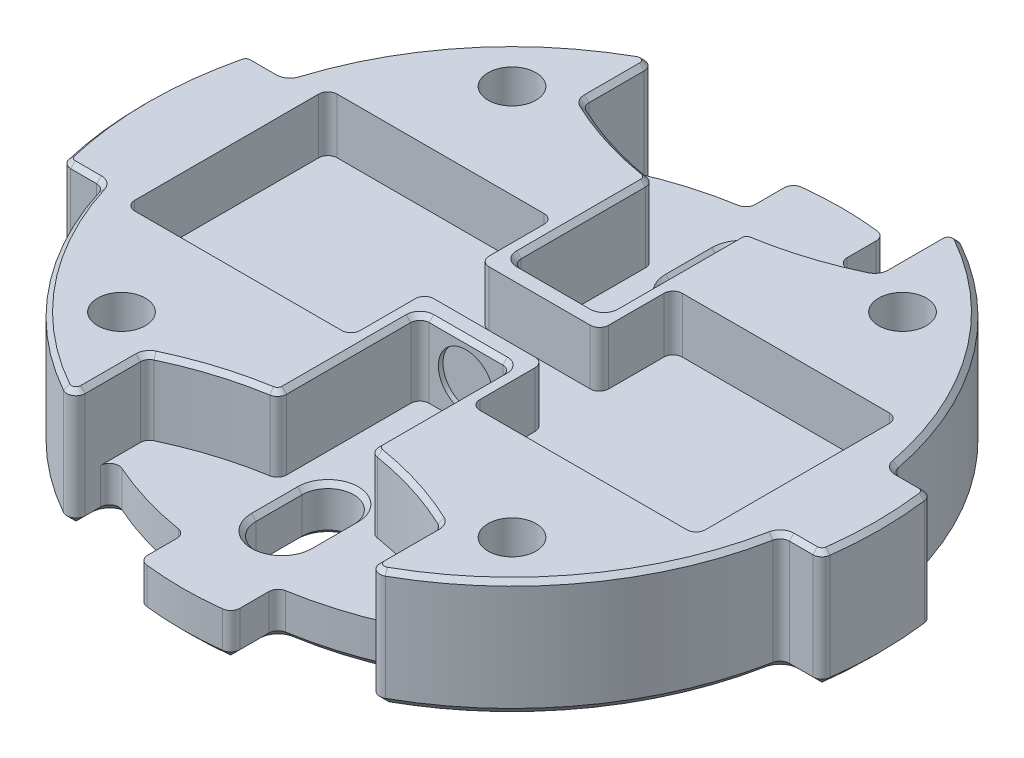
from build123d import *

# Parameters (mm, degrees)
EXTRUDE_1_DEPTH      = 13
CUT_EXTRUDE_START    = -8.1
CUT_EXTRUDE_1_DEPTH  = 8.1
CUT_EXTRUDE_START_2  = -8
CUT_EXTRUDE_2_DEPTH  = 8
CUT_EXTRUDE_6_DEPTH  = 6
FILLET_1_R           = 1
CUT_EXTRUDE_7_DEPTH  = 6
CHAMFER_2_SIZE       = 0.5
CHAMFER_4_SIZE       = 1
SKETCH_9_R           = 3
CUT_EXTRUDE_8_DEPTH  = 0.5
CUT_EXTRUDE_START_3  = -0.5
SKETCH_10_R          = 3
CUT_EXTRUDE_9_DEPTH  = 0.5
SKETCH_11_R          = 2.6
CUT_EXTRUDE_10_DEPTH = 15
SKETCH_12_R          = 4.5
CUT_EXTRUDE_11_DEPTH = 5.2
CHAMFER_5_SIZE       = 0.5


with BuildPart() as part:
    # 草图1 → 凸台-拉伸1 (new body)
    with BuildSketch(Plane(origin=(0, 0, 0), x_dir=(1, 0, 0), z_dir=(0, 1, 0))):
        with BuildLine():
            Line((-38.729833462, 10), (-34.374990909, 10))
            ThreePointArc((-34.374990909, 10), (2.052065392, 35.741139148), (35.293625487, 6))
            Line((35.293625487, 6), (39.547439867, 6))
            ThreePointArc((39.547439867, 6), (40, 0), (39.547439867, -6))
            Line((39.547439867, -6), (35.293625487, -6))
            ThreePointArc((35.293625487, -6), (2.052065392, -35.741139148), (-34.374990909, -10))
            Line((-34.374990909, -10), (-38.729833462, -10))
            ThreePointArc((-38.729833462, -10), (-40, 0), (-38.729833462, 10))
        make_face()
    extrude(amount=EXTRUDE_1_DEPTH)

    # 草图2 → 切除-拉伸1 (cut)
    with BuildSketch(Plane(origin=(0, 13, 0), x_dir=(1, 0, 0), z_dir=(0, 1, 0)).offset(CUT_EXTRUDE_START)):
        with BuildLine():
            Line((5, -5), (-5, -5))
            Line((-5, -5), (-5, -20.34891306))
            ThreePointArc((-5, -20.34891306), (-10.636893163, -21.607319037), (-16, -23.750969007))
            Line((-16, -23.750969007), (-16, -32.025614748))
            ThreePointArc((-16, -32.025614748), (0, -35.8), (16, -32.025614748))
            Line((16, -32.025614748), (16, -23.750969007))
            ThreePointArc((16, -23.750969007), (10.636893163, -21.607319037), (5, -20.34891306))
            Line((5, -20.34891306), (5, -5))
        make_face()
        with BuildLine():
            ThreePointArc((-5, 20.34891306), (-10.636893163, 21.607319037), (-16, 23.750969007))
            Line((-16, 23.750969007), (-16, 32.025614748))
            ThreePointArc((-16, 32.025614748), (0, 35.8), (16, 32.025614748))
            Line((16, 32.025614748), (16, 23.750969007))
            ThreePointArc((16, 23.750969007), (10.636893163, 21.607319037), (5, 20.34891306))
            Line((5, 20.34891306), (5, 5))
            Line((5, 5), (-5, 5))
            Line((-5, 5), (-5, 20.34891306))
        make_face()
    extrude(amount=CUT_EXTRUDE_1_DEPTH, mode=Mode.SUBTRACT)

    # 草图3 → 切除-拉伸2 (cut)
    with BuildSketch(Plane(origin=(0, 4.9, 0), x_dir=(1, 0, 0), z_dir=(0, 1, 0)).offset(CUT_EXTRUDE_START_2)):
        with BuildLine():
            Line((-5, 30.550105485), (-5, 35.449118466))
            ThreePointArc((-5, 35.449118466), (-10.63861337, 34.182742804), (-16, 32.025614748))
            Line((-16, 32.025614748), (-16, 27.137361435))
            ThreePointArc((-16, 27.137361435), (-10.63774908, 29.287728045), (-5, 30.550105485))
        make_face()
        with BuildLine():
            Line((5, 30.550105485), (5, 35.449118466))
            ThreePointArc((5, 35.449118466), (10.63861337, 34.182742804), (16, 32.025614748))
            Line((16, 32.025614748), (16, 27.137361435))
            ThreePointArc((16, 27.137361435), (10.63774908, 29.287728045), (5, 30.550105485))
        make_face()
        with BuildLine():
            Line((-5, -30.550105485), (-5, -35.449118466))
            ThreePointArc((-5, -35.449118466), (-10.63861337, -34.182742804), (-16, -32.025614748))
            Line((-16, -32.025614748), (-16, -27.137361435))
            ThreePointArc((-16, -27.137361435), (-10.63774908, -29.287728045), (-5, -30.550105485))
        make_face()
        with BuildLine():
            Line((5, -30.550105485), (5, -35.449118466))
            ThreePointArc((5, -35.449118466), (10.63861337, -34.182742804), (16, -32.025614748))
            Line((16, -32.025614748), (16, -27.137361435))
            ThreePointArc((16, -27.137361435), (10.63774908, -29.287728045), (5, -30.550105485))
        make_face()
    extrude(amount=CUT_EXTRUDE_2_DEPTH, mode=Mode.SUBTRACT)

    # 草图7 → 切除-拉伸6 (cut)
    with BuildSketch(Plane(origin=(0, 13, 0), x_dir=(1, 0, 0), z_dir=(0, 1, 0))):
        Polygon((-31, 11), (-6.5, 11), (-6.5, 3), (6.5, 3), (6.5, 11), (31, 11), (31, -11), (6.5, -11), (6.5, -3), (-6.5, -3), (-6.5, -11), (-31, -11), align=None)
    extrude(amount=-CUT_EXTRUDE_6_DEPTH, mode=Mode.SUBTRACT)

    # 圆角1
    fillet_1_edges = [part.edges().sort_by_distance(p)[0] for p in [
        (-16, 2.45, 27.137361435),
        (-5, 2.45, 30.550105485),
        (-5, 2.45, 35.449118466),
        (5, 2.45, 30.550105485),
        (16, 2.45, 27.137361435),
        (5, 2.45, 35.449118466),
        (-5, 2.45, -30.550105485),
        (-16, 2.45, -27.137361435),
        (-5, 2.45, -35.449118466),
        (-38.729833462, 6.5, -10),
        (-34.374990909, 6.5, -10),
        (35.293625487, 6.5, -6),
        (39.547439867, 6.5, -6),
        (39.547439867, 6.5, 6),
        (35.293625487, 6.5, 6),
        (-34.374990909, 6.5, 10),
        (-38.729833462, 6.5, 10),
        (-31, 10, 11),
        (-31, 10, -11),
        (-6.5, 10, -11),
        (-6.5, 10, -3),
        (6.5, 10, -3),
        (6.5, 10, -11),
        (31, 10, -11),
        (31, 10, 11),
        (6.5, 10, 11),
        (6.5, 10, 3),
        (-6.5, 10, 3),
        (-6.5, 10, 11),
        (-5, 8.95, 20.34891306),
        (-5, 8.95, 5),
        (5, 8.95, 5),
        (5, 8.95, 20.34891306),
        (16, 8.95, 23.750969007),
        (16, 6.5, 32.025614748),
        (-16, 6.5, 32.025614748),
        (-16, 8.95, 23.750969007),
        (-5, 8.95, -5),
        (-5, 8.95, -20.34891306),
        (-16, 8.95, -23.750969007),
        (-16, 6.5, -32.025614748),
        (16, 6.5, -32.025614748),
        (16, 8.95, -23.750969007),
        (5, 8.95, -20.34891306),
        (5, 8.95, -5),
        (5, 2.45, -35.449118466),
        (16, 2.45, -27.137361435),
        (5, 2.45, -30.550105485),
    ]]
    fillet(fillet_1_edges, radius=FILLET_1_R)

    # 草图8 → 切除-拉伸7 (cut)
    with BuildSketch(Plane(origin=(0, 4.9, 0), x_dir=(1, 0, 0), z_dir=(0, 1, 0))):
        with BuildLine():
            Line((2.8, -20), (2.8, -25))
            ThreePointArc((2.8, -25), (0, -27.8), (-2.8, -25))
            Line((-2.8, -25), (-2.8, -20))
            ThreePointArc((-2.8, -20), (0, -17.2), (2.8, -20))
        make_face()
        with BuildLine():
            Line((2.8, 20), (2.8, 25))
            ThreePointArc((2.8, 25), (0, 27.8), (-2.8, 25))
            Line((-2.8, 25), (-2.8, 20))
            ThreePointArc((-2.8, 20), (0, 17.2), (2.8, 20))
        make_face()
    extrude(amount=-CUT_EXTRUDE_7_DEPTH, mode=Mode.SUBTRACT)

    # 倒角2
    chamfer_2_edges = [part.edges().sort_by_distance(p)[0] for p in [
        (0, 0, 17.2),
        (2.8, 0, 22.5),
        (0, 0, 27.8),
        (-2.8, 0, 22.5),
        (0, 4.9, 17.2),
        (-2.8, 4.9, 22.5),
        (0, 4.9, 27.8),
        (2.8, 4.9, 22.5),
        (0, 0, -17.2),
        (-2.8, 0, -22.5),
        (0, 0, -27.8),
        (2.8, 0, -22.5),
        (0, 4.9, -17.2),
        (2.8, 4.9, -22.5),
        (0, 4.9, -27.8),
        (-2.8, 4.9, -22.5),
    ]]
    chamfer(chamfer_2_edges, length=CHAMFER_2_SIZE)

    # 倒角4
    chamfer_4_edges = [part.edges().sort_by_distance(p)[0] for p in [
        (-16, 0, -29.539379324),
        (16, 0, -29.539379324),
        (16, 0, 29.539379324),
        (-16, 0, 29.539379324),
        (29.013579763, 0, 20.972653369),
        (10.299242352, 0, -29.390923323),
        (29.013579763, 0, -20.972653369),
        (37.403132307, 0, -6),
        (40, 0, 0),
        (37.403132307, 0, 6),
        (10.299242352, 0, 29.390923323),
        (5, 0, 32.989139032),
        (0, 0, 35.8),
        (-5, 0, 32.989139032),
        (-10.299242352, 0, 29.390923323),
        (-27.7923273, 0, 22.566048464),
        (-36.532424459, 0, 10),
        (-40, 0, 0),
        (-36.532424459, 0, -10),
        (-27.7923273, 0, -22.566048464),
        (-10.299242352, 0, -29.390923323),
        (-5, 0, -32.989139032),
        (0, 0, -35.8),
        (5, 0, -32.989139032),
        (39.338384503, 0, 5.751067616),
        (39.338384503, 0, -5.751067616),
        (16.494285529, 0, -31.227812477),
        (4.746639983, 0, -35.23457892),
        (-4.746639983, 0, -35.23457892),
        (-16.494285529, 0, -31.227812477),
        (-38.567505595, 0, -9.784464541),
        (-38.567505595, 0, 9.784464541),
        (-16.494285529, 0, 31.227812477),
        (-4.746639983, 0, 35.23457892),
        (4.746639983, 0, 35.23457892),
        (16.494285529, 0, 31.227812477),
        (15.544745782, 0, 27.875045853),
        (5.237569142, 0, 30.761857784),
        (-5.237569142, 0, 30.761857784),
        (-15.544745782, 0, 27.875045853),
        (-34.525449873, 0, 10.194111347),
        (-34.525449873, 0, -10.194111347),
        (-15.544745782, 0, -27.875045853),
        (-5.237569142, 0, -30.761857784),
        (5.237569142, 0, -30.761857784),
        (15.544745782, 0, -27.875045853),
        (35.491794705, 0, -6.228567115),
        (35.491794705, 0, 6.228567115),
    ]]
    chamfer(chamfer_4_edges, length=CHAMFER_4_SIZE)

    # 草图9 → 切除-拉伸8 (cut)
    with BuildSketch(Plane(origin=(0, 0, -5), x_dir=(-1, 0, 0), z_dir=(0, 0, -1))):
        with Locations((0, 8.95)):
            Circle(SKETCH_9_R)
    extrude(amount=-CUT_EXTRUDE_8_DEPTH, mode=Mode.SUBTRACT)

    # 草图10 → 切除-拉伸9 (cut)
    with BuildSketch(Plane.XY.offset(5).offset(CUT_EXTRUDE_START_3)):
        with Locations(Location((0, 8.95, 0), (0, 0, 180))):
            Circle(SKETCH_10_R)
    extrude(amount=CUT_EXTRUDE_9_DEPTH, mode=Mode.SUBTRACT)

    # 草图11 → 切除-拉伸10 (cut)
    with BuildSketch(Plane.XZ):
        with Locations(Location((-21.213203436, 21.213203436, 0), (0, 0, 270))):
            Circle(SKETCH_11_R)
        with Locations(Location((21.213203436, 21.213203436, 0), (0, 0, 270))):
            Circle(SKETCH_11_R)
        with Locations(Location((21.213203436, -21.213203436, 0), (0, 0, 270))):
            Circle(SKETCH_11_R)
        with Locations(Location((-21.213203436, -21.213203436, 0), (0, 0, 270))):
            Circle(SKETCH_11_R)
    extrude(amount=-CUT_EXTRUDE_10_DEPTH, mode=Mode.SUBTRACT)

    # 草图12 → 切除-拉伸11 (cut)
    with BuildSketch(Plane.XZ):
        with Locations(Location((-21.213203436, 21.213203436, 0), (0, 0, 270))):
            Circle(SKETCH_12_R)
        with Locations(Location((21.213203436, 21.213203436, 0), (0, 0, 270))):
            Circle(SKETCH_12_R)
        with Locations(Location((21.213203436, -21.213203436, 0), (0, 0, 270))):
            Circle(SKETCH_12_R)
        with Locations(Location((-21.213203436, -21.213203436, 0), (0, 0, 270))):
            Circle(SKETCH_12_R)
    extrude(amount=-CUT_EXTRUDE_11_DEPTH, mode=Mode.SUBTRACT)

    # 倒角5
    # the kernel refuses this chamfer: 0.5 mm, written as the material it takes off along each edge
    with BuildSketch(Plane(origin=(0, 13, -56), x_dir=(-0.1621621621621622, 0, 0.9867641223529018), z_dir=(0.9867641223529018, 0, 0.1621621621621622))) as chamfer_5_piece_1:
        Polygon((36 + CHAMFER_5_SIZE, 0), (36, CHAMFER_5_SIZE), (36, 0), align=None)
    revolve(axis=Axis((0, 13, -56), (0, -1, 0)), revolution_arc=16.044515341, mode=Mode.SUBTRACT)
    with BuildSketch(Plane(origin=(-16, 13, -24.377223398), x_dir=(0.02749587661059945, -0.9996219169112963, 0), z_dir=(0, 0, -1)), Plane(origin=(16, 13, -30.365111559), x_dir=(-0.027495876610585647, -0.9996219169112968, 0), z_dir=(0, 0, 1))) as chamfer_5_piece_2:
        Polygon((CHAMFER_5_SIZE * 0.999621916911, CHAMFER_5_SIZE * 0.0274958766106), (-CHAMFER_5_SIZE * 0.0274958766106, CHAMFER_5_SIZE * 0.999621916911), (0, 0), align=None)
    extrude(amount=5.987888161, mode=Mode.SUBTRACT)
    with BuildSketch(Plane(origin=(0, 13, -56), x_dir=(0.42857142857142727, 0, 0.903507902905252), z_dir=(0.903507902905252, 0, -0.42857142857142727))) as chamfer_5_piece_3:
        Polygon((36 + CHAMFER_5_SIZE, 0), (36, CHAMFER_5_SIZE), (36, 0), align=None)
    revolve(axis=Axis((0, 13, -56), (0, -1, 0)), revolution_arc=16.044515341, mode=Mode.SUBTRACT)
    with BuildSketch(Plane(origin=(0, 13, 56), x_dir=(0.42857142857142805, 0, -0.9035079029052516), z_dir=(0.9035079029052516, 0, 0.42857142857142805))) as chamfer_5_piece_4:
        Polygon((36 + CHAMFER_5_SIZE, 0), (36, -CHAMFER_5_SIZE), (36, 0), align=None)
    revolve(axis=Axis((0, 13, 56), (0, 1, 0)), revolution_arc=16.044515341, mode=Mode.SUBTRACT)
    with BuildSketch(Plane(origin=(16, 13, 30.365111559), x_dir=(-0.027495876610585647, -0.9996219169112968, 0), z_dir=(0, 0, -1)), Plane(origin=(-16, 13, 24.377223398), x_dir=(0.027495876610578746, -0.999621916911297, 0), z_dir=(0, 0, 1))) as chamfer_5_piece_5:
        Polygon((CHAMFER_5_SIZE * 0.999621916911, -CHAMFER_5_SIZE * 0.0274958766106), (-CHAMFER_5_SIZE * 0.0274958766106, -CHAMFER_5_SIZE * 0.999621916911), (0, 0), align=None)
    extrude(amount=5.987888161, mode=Mode.SUBTRACT)
    with BuildSketch(Plane(origin=(0, 13, 0), x_dir=(0.9817419946428738, 0, 0.19021739130434767), z_dir=(0.19021739130434767, 0, -0.9817419946428738))) as chamfer_5_piece_6:
        Polygon((35.8, CHAMFER_5_SIZE), (35.8 - CHAMFER_5_SIZE, 0), (35.8, 0), align=None)
    revolve(axis=Axis((0, 13, 0), (0, -1, 0)), revolution_arc=49.792112923, mode=Mode.SUBTRACT)
    with BuildSketch(Plane(origin=(38.678159212, 13, 6), x_dir=(0, -0.9996219169112968, 0.027495876610585647), z_dir=(-1, 0, 0)), Plane(origin=(36.128105403, 13, -6), x_dir=(0, -0.9996219169112968, -0.027495876610585647), z_dir=(1, 0, 0))) as chamfer_5_piece_7:
        Polygon((CHAMFER_5_SIZE * 0.999621916911, -CHAMFER_5_SIZE * 0.0274958766106), (-CHAMFER_5_SIZE * 0.0274958766106, -CHAMFER_5_SIZE * 0.999621916911), (0, 0), align=None)
    extrude(amount=2.550053809, mode=Mode.SUBTRACT)
    with BuildSketch(Plane(origin=(0, 13, 0), x_dir=(0.9917476720930114, 0, -0.12820512820512653), z_dir=(-0.12820512820512653, 0, -0.9917476720930114))) as chamfer_5_piece_8:
        Polygon((40, CHAMFER_5_SIZE), (40 - CHAMFER_5_SIZE, 0), (40, 0), align=None)
    revolve(axis=Axis((0, 13, 0), (0, -1, 0)), revolution_arc=14.731771658, mode=Mode.SUBTRACT)
    with BuildSketch(Plane(origin=(0, 13, 0), x_dir=(0.4885057471264368, 0, -0.8725606769872465), z_dir=(-0.8725606769872465, 0, -0.4885057471264368))) as chamfer_5_piece_9:
        Polygon((35.8, CHAMFER_5_SIZE), (35.8 - CHAMFER_5_SIZE, 0), (35.8, 0), align=None)
    revolve(axis=Axis((0, 13, 0), (0, -1, 0)), revolution_arc=49.792112923, mode=Mode.SUBTRACT)
    with BuildSketch(Plane(origin=(5, 13, -19.489727473), x_dir=(0.9996219169112968, 0.027495876610585647, 0), z_dir=(0, 0, 1)), Plane(origin=(-5, 13, -6), x_dir=(-0.9996219169112968, 0.027495876610585647, 0), z_dir=(0, 0, -1))) as chamfer_5_piece_10:
        Polygon((CHAMFER_5_SIZE * 0.999621916911, -CHAMFER_5_SIZE * 0.0274958766106), (-CHAMFER_5_SIZE * 0.0274958766106, -CHAMFER_5_SIZE * 0.999621916911), (0, 0), align=None)
    extrude(amount=13.489727473, mode=Mode.SUBTRACT)
    with BuildSketch(Plane(origin=(4, 13, -5), x_dir=(0, 0.027495876610585647, 0.9996219169112968), z_dir=(-1, 0, 0))) as chamfer_5_piece_11:
        Polygon((CHAMFER_5_SIZE * 0.999621916911, -CHAMFER_5_SIZE * 0.0274958766106), (-CHAMFER_5_SIZE * 0.0274958766106, -CHAMFER_5_SIZE * 0.999621916911), (0, 0), align=None)
    extrude(amount=8, mode=Mode.SUBTRACT)
    with BuildSketch(Plane(origin=(0, 13, 0), x_dir=(-0.9542803531659673, 0, -0.29891304347826125), z_dir=(-0.29891304347826125, 0, 0.9542803531659673))) as chamfer_5_piece_12:
        Polygon((35.8, CHAMFER_5_SIZE), (35.8 - CHAMFER_5_SIZE, 0), (35.8, 0), align=None)
    revolve(axis=Axis((0, 13, 0), (0, -1, 0)), revolution_arc=43.3652544, mode=Mode.SUBTRACT)
    with BuildSketch(Plane(origin=(-37.947331922, 13, -10), x_dir=(0, -0.9996219169112968, -0.027495876610585647), z_dir=(1, 0, 0)), Plane(origin=(-35.117516997, 13, 10), x_dir=(0, -0.9996219169112968, 0.027495876610585647), z_dir=(-1, 0, 0))) as chamfer_5_piece_13:
        Polygon((CHAMFER_5_SIZE * 0.999621916911, -CHAMFER_5_SIZE * 0.0274958766106), (-CHAMFER_5_SIZE * 0.0274958766106, -CHAMFER_5_SIZE * 0.999621916911), (0, 0), align=None)
    extrude(amount=2.829814926, mode=Mode.SUBTRACT)
    with BuildSketch(Plane(origin=(0, 13, 0), x_dir=(-0.9730085108210398, 0, 0.2307692307692311), z_dir=(0.2307692307692311, 0, 0.9730085108210398))) as chamfer_5_piece_14:
        Polygon((40, CHAMFER_5_SIZE), (40 - CHAMFER_5_SIZE, 0), (40, 0), align=None)
    revolve(axis=Axis((0, 13, 0), (0, -1, 0)), revolution_arc=26.684727594, mode=Mode.SUBTRACT)
    with BuildSketch(Plane(origin=(0, 13, 0), x_dir=(-0.4885057471264368, 0, 0.8725606769872465), z_dir=(0.8725606769872465, 0, 0.4885057471264368))) as chamfer_5_piece_15:
        Polygon((35.8, CHAMFER_5_SIZE), (35.8 - CHAMFER_5_SIZE, 0), (35.8, 0), align=None)
    revolve(axis=Axis((0, 13, 0), (0, -1, 0)), revolution_arc=43.3652544, mode=Mode.SUBTRACT)
    with BuildSketch(Plane(origin=(0, 13, 56), x_dir=(-0.16216216216216323, 0, -0.9867641223529017), z_dir=(0.9867641223529017, 0, -0.16216216216216323))) as chamfer_5_piece_16:
        Polygon((36 + CHAMFER_5_SIZE, 0), (36, -CHAMFER_5_SIZE), (36, 0), align=None)
    revolve(axis=Axis((0, 13, 56), (0, 1, 0)), revolution_arc=16.044515341, mode=Mode.SUBTRACT)
    with BuildSketch(Plane(origin=(-5, 13, 6), x_dir=(-0.9996219169112968, 0.027495876610585647, 0), z_dir=(0, 0, 1)), Plane(origin=(5, 13, 19.489727473), x_dir=(0.9996219169112968, 0.027495876610585647, 0), z_dir=(0, 0, -1))) as chamfer_5_piece_17:
        Polygon((CHAMFER_5_SIZE * 0.999621916911, CHAMFER_5_SIZE * 0.0274958766106), (-CHAMFER_5_SIZE * 0.0274958766106, CHAMFER_5_SIZE * 0.999621916911), (0, 0), align=None)
    extrude(amount=13.489727473, mode=Mode.SUBTRACT)
    with BuildSketch(Plane(origin=(4, 13, 5), x_dir=(0, 0.027495876610585647, -0.9996219169112968), z_dir=(-1, 0, 0))) as chamfer_5_piece_18:
        Polygon((CHAMFER_5_SIZE * 0.999621916911, CHAMFER_5_SIZE * 0.0274958766106), (-CHAMFER_5_SIZE * 0.0274958766106, CHAMFER_5_SIZE * 0.999621916911), (0, 0), align=None)
    extrude(amount=8, mode=Mode.SUBTRACT)
    with BuildSketch(Plane(origin=(38.678159212, 13, 5), x_dir=(0, 0, 1), z_dir=(-1, 0, 0))) as chamfer_5_piece_19:
        Polygon((1 - CHAMFER_5_SIZE, 0), (1, -CHAMFER_5_SIZE), (1, 0), align=None)
    revolve(axis=Axis((38.678159212, 13, 5), (0, 1, 0)), revolution_arc=82.634114171, mode=Mode.SUBTRACT)
    with BuildSketch(Plane(origin=(38.678159212, 13, -5), x_dir=(0.9917476720930116, 0, -0.12820512820512497), z_dir=(0.12820512820512497, 0, 0.9917476720930116))) as chamfer_5_piece_20:
        Polygon((1 - CHAMFER_5_SIZE, 0), (1, -CHAMFER_5_SIZE), (1, 0), align=None)
    revolve(axis=Axis((38.678159212, 13, -5), (0, 1, 0)), revolution_arc=82.634114171, mode=Mode.SUBTRACT)
    with BuildSketch(Plane(origin=(17, 13, -30.365111559), x_dir=(0.4885057471264348, 0, -0.8725606769872475), z_dir=(0.8725606769872475, 0, 0.4885057471264348))) as chamfer_5_piece_21:
        Polygon((1 - CHAMFER_5_SIZE, 0), (1, -CHAMFER_5_SIZE), (1, 0), align=None)
    revolve(axis=Axis((17, 13, -30.365111559), (0, 1, 0)), revolution_arc=119.242415903, mode=Mode.SUBTRACT)
    with BuildSketch(Plane(origin=(-17, 13, -30.365111559), x_dir=(-0.4885057471264348, 0, -0.8725606769872475), z_dir=(-0.8725606769872475, 0, 0.4885057471264348))) as chamfer_5_piece_22:
        Polygon((1, CHAMFER_5_SIZE), (1 - CHAMFER_5_SIZE, 0), (1, 0), align=None)
    revolve(axis=Axis((-17, 13, -30.365111559), (0, -1, 0)), revolution_arc=119.242415903, mode=Mode.SUBTRACT)
    with BuildSketch(Plane(origin=(-37.947331922, 13, -9), x_dir=(0, 0, -1), z_dir=(1, 0, 0))) as chamfer_5_piece_23:
        Polygon((1 - CHAMFER_5_SIZE, 0), (1, -CHAMFER_5_SIZE), (1, 0), align=None)
    revolve(axis=Axis((-37.947331922, 13, -9), (0, 1, 0)), revolution_arc=76.657636203, mode=Mode.SUBTRACT)
    with BuildSketch(Plane(origin=(-37.947331922, 13, 9), x_dir=(-0.97300851082104, 0, 0.2307692307692302), z_dir=(-0.2307692307692302, 0, -0.97300851082104))) as chamfer_5_piece_24:
        Polygon((1 - CHAMFER_5_SIZE, 0), (1, -CHAMFER_5_SIZE), (1, 0), align=None)
    revolve(axis=Axis((-37.947331922, 13, 9), (0, 1, 0)), revolution_arc=76.657636203, mode=Mode.SUBTRACT)
    with BuildSketch(Plane(origin=(-17, 13, 30.365111559), x_dir=(-0.48850574712643907, 0, 0.8725606769872453), z_dir=(-0.8725606769872453, 0, -0.48850574712643907))) as chamfer_5_piece_25:
        Polygon((1 - CHAMFER_5_SIZE, 0), (1, -CHAMFER_5_SIZE), (1, 0), align=None)
    revolve(axis=Axis((-17, 13, 30.365111559), (0, 1, 0)), revolution_arc=119.242415903, mode=Mode.SUBTRACT)
    with BuildSketch(Plane(origin=(17, 13, 30.365111559), x_dir=(-1, 0, 0), z_dir=(0, 0, -1))) as chamfer_5_piece_26:
        Polygon((1 - CHAMFER_5_SIZE, 0), (1, -CHAMFER_5_SIZE), (1, 0), align=None)
    revolve(axis=Axis((17, 13, 30.365111559), (0, 1, 0)), revolution_arc=119.242415903, mode=Mode.SUBTRACT)
    with BuildSketch(Plane(origin=(-6, 13, 19.489727473), x_dir=(0.16216216216216225, 0, 0.9867641223529018), z_dir=(-0.9867641223529018, 0, 0.16216216216216225))) as chamfer_5_piece_27:
        Polygon((1 - CHAMFER_5_SIZE, 0), (1, -CHAMFER_5_SIZE), (1, 0), align=None)
    revolve(axis=Axis((-6, 13, 19.489727473), (0, 1, 0)), revolution_arc=80.667581816, mode=Mode.SUBTRACT)
    with BuildSketch(Plane(origin=(6, 13, 19.489727473), x_dir=(-1, 0, 0), z_dir=(0, 0, -1))) as chamfer_5_piece_28:
        Polygon((1 - CHAMFER_5_SIZE, 0), (1, -CHAMFER_5_SIZE), (1, 0), align=None)
    revolve(axis=Axis((6, 13, 19.489727473), (0, 1, 0)), revolution_arc=80.667581816, mode=Mode.SUBTRACT)
    with BuildSketch(Plane(origin=(-6, 13, -19.489727473), x_dir=(0.16216216216216053, 0, -0.9867641223529021), z_dir=(-0.9867641223529021, 0, -0.16216216216216053))) as chamfer_5_piece_29:
        Polygon((1 - CHAMFER_5_SIZE, 0), (1, CHAMFER_5_SIZE), (1, 0), align=None)
    revolve(axis=Axis((-6, 13, -19.489727473), (0, -1, 0)), revolution_arc=80.667581816, mode=Mode.SUBTRACT)
    with BuildSketch(Plane(origin=(6, 13, -19.489727473), x_dir=(-1, 0, 0), z_dir=(0, 0, 1))) as chamfer_5_piece_30:
        Polygon((1 - CHAMFER_5_SIZE, 0), (1, CHAMFER_5_SIZE), (1, 0), align=None)
    revolve(axis=Axis((6, 13, -19.489727473), (0, -1, 0)), revolution_arc=80.667581816, mode=Mode.SUBTRACT)
    with BuildSketch(Plane(origin=(-15, 13, -24.377223398), x_dir=(-1, 0, 0), z_dir=(0, 0, -1))) as chamfer_5_piece_31:
        Polygon((1 + CHAMFER_5_SIZE, 0), (1, -CHAMFER_5_SIZE), (1, 0), align=None)
    revolve(axis=Axis((-15, 13, -24.377223398), (0, 1, 0)), revolution_arc=64.623066475, mode=Mode.SUBTRACT)
    with BuildSketch(Plane(origin=(15, 13, -24.377223398), x_dir=(1, 0, 0), z_dir=(0, 0, -1))) as chamfer_5_piece_32:
        Polygon((1 + CHAMFER_5_SIZE, 0), (1, CHAMFER_5_SIZE), (1, 0), align=None)
    revolve(axis=Axis((15, 13, -24.377223398), (0, -1, 0)), revolution_arc=64.623066475, mode=Mode.SUBTRACT)
    with BuildSketch(Plane(origin=(-4, 13, -6), x_dir=(-1, 0, 0), z_dir=(0, 0, -1))) as chamfer_5_piece_33:
        Polygon((1 + CHAMFER_5_SIZE, 0), (1, -CHAMFER_5_SIZE), (1, 0), align=None)
    revolve(axis=Axis((-4, 13, -6), (0, 1, 0)), revolution_arc=90, mode=Mode.SUBTRACT)
    with BuildSketch(Plane(origin=(4, 13, -6), x_dir=(0, 0, 1), z_dir=(-1, 0, 0))) as chamfer_5_piece_34:
        Polygon((1 + CHAMFER_5_SIZE, 0), (1, -CHAMFER_5_SIZE), (1, 0), align=None)
    revolve(axis=Axis((4, 13, -6), (0, 1, 0)), revolution_arc=90, mode=Mode.SUBTRACT)
    with BuildSketch(Plane(origin=(-4, 13, 6), x_dir=(-1, 0, 0), z_dir=(0, 0, 1))) as chamfer_5_piece_35:
        Polygon((1 + CHAMFER_5_SIZE, 0), (1, CHAMFER_5_SIZE), (1, 0), align=None)
    revolve(axis=Axis((-4, 13, 6), (0, -1, 0)), revolution_arc=90, mode=Mode.SUBTRACT)
    with BuildSketch(Plane(origin=(4, 13, 6), x_dir=(0, 0, -1), z_dir=(-1, 0, 0))) as chamfer_5_piece_36:
        Polygon((1 + CHAMFER_5_SIZE, 0), (1, CHAMFER_5_SIZE), (1, 0), align=None)
    revolve(axis=Axis((4, 13, 6), (0, -1, 0)), revolution_arc=90, mode=Mode.SUBTRACT)
    with BuildSketch(Plane(origin=(15, 13, 24.377223398), x_dir=(1, 0, 0), z_dir=(0, 0, 1))) as chamfer_5_piece_37:
        Polygon((1 + CHAMFER_5_SIZE, 0), (1, -CHAMFER_5_SIZE), (1, 0), align=None)
    revolve(axis=Axis((15, 13, 24.377223398), (0, 1, 0)), revolution_arc=64.623066475, mode=Mode.SUBTRACT)
    with BuildSketch(Plane(origin=(-15, 13, 24.377223398), x_dir=(-1, 0, 0), z_dir=(0, 0, 1))) as chamfer_5_piece_38:
        Polygon((1 + CHAMFER_5_SIZE, 0), (1, CHAMFER_5_SIZE), (1, 0), align=None)
    revolve(axis=Axis((-15, 13, 24.377223398), (0, -1, 0)), revolution_arc=64.623066475, mode=Mode.SUBTRACT)
    with BuildSketch(Plane(origin=(-35.117516997, 13, 11), x_dir=(0, 0, -1), z_dir=(-1, 0, 0))) as chamfer_5_piece_39:
        Polygon((1, CHAMFER_5_SIZE), (1 + CHAMFER_5_SIZE, 0), (1, 0), align=None)
    revolve(axis=Axis((-35.117516997, 13, 11), (0, -1, 0)), revolution_arc=72.607670303, mode=Mode.SUBTRACT)
    with BuildSketch(Plane(origin=(-35.117516997, 13, -11), x_dir=(0, 0, 1), z_dir=(-1, 0, 0))) as chamfer_5_piece_40:
        Polygon((1, -CHAMFER_5_SIZE), (1 + CHAMFER_5_SIZE, 0), (1, 0), align=None)
    revolve(axis=Axis((-35.117516997, 13, -11), (0, 1, 0)), revolution_arc=72.607670303, mode=Mode.SUBTRACT)
    with BuildSketch(Plane(origin=(36.128105403, 13, -7), x_dir=(0, 0, 1), z_dir=(1, 0, 0))) as chamfer_5_piece_41:
        Polygon((1, CHAMFER_5_SIZE), (1 + CHAMFER_5_SIZE, 0), (1, 0), align=None)
    revolve(axis=Axis((36.128105403, 13, -7), (0, -1, 0)), revolution_arc=79.034528825, mode=Mode.SUBTRACT)
    with BuildSketch(Plane(origin=(36.128105403, 13, 7), x_dir=(-0.9817419946428736, 0, -0.1902173913043493), z_dir=(-0.1902173913043493, 0, 0.9817419946428736))) as chamfer_5_piece_42:
        Polygon((1, CHAMFER_5_SIZE), (1 + CHAMFER_5_SIZE, 0), (1, 0), align=None)
    revolve(axis=Axis((36.128105403, 13, 7), (0, -1, 0)), revolution_arc=79.034528825, mode=Mode.SUBTRACT)
    with BuildSketch(Plane(origin=(-21.213203436, 0, -21.213203436), x_dir=(0, 0, -1), z_dir=(-1, 0, 0))) as chamfer_5_piece_43:
        Polygon((4.5 + CHAMFER_5_SIZE, 0), (4.5, -CHAMFER_5_SIZE), (4.5, 0), align=None)
    revolve(axis=Axis((-21.213203436, 0, -21.213203436), (0, -1, 0)), mode=Mode.SUBTRACT)
    with BuildSketch(Plane(origin=(21.213203436, 0, -21.213203436), x_dir=(0, 0, -1), z_dir=(-1, 0, 0))) as chamfer_5_piece_44:
        Polygon((4.5 + CHAMFER_5_SIZE, 0), (4.5, -CHAMFER_5_SIZE), (4.5, 0), align=None)
    revolve(axis=Axis((21.213203436, 0, -21.213203436), (0, -1, 0)), mode=Mode.SUBTRACT)
    with BuildSketch(Plane(origin=(21.213203436, 0, 21.213203436), x_dir=(0, 0, -1), z_dir=(-1, 0, 0))) as chamfer_5_piece_45:
        Polygon((4.5 + CHAMFER_5_SIZE, 0), (4.5, -CHAMFER_5_SIZE), (4.5, 0), align=None)
    revolve(axis=Axis((21.213203436, 0, 21.213203436), (0, -1, 0)), mode=Mode.SUBTRACT)
    with BuildSketch(Plane(origin=(-21.213203436, 0, 21.213203436), x_dir=(0, 0, -1), z_dir=(-1, 0, 0))) as chamfer_5_piece_46:
        Polygon((4.5 + CHAMFER_5_SIZE, 0), (4.5, -CHAMFER_5_SIZE), (4.5, 0), align=None)
    revolve(axis=Axis((-21.213203436, 0, 21.213203436), (0, -1, 0)), mode=Mode.SUBTRACT)


solid = part.part
